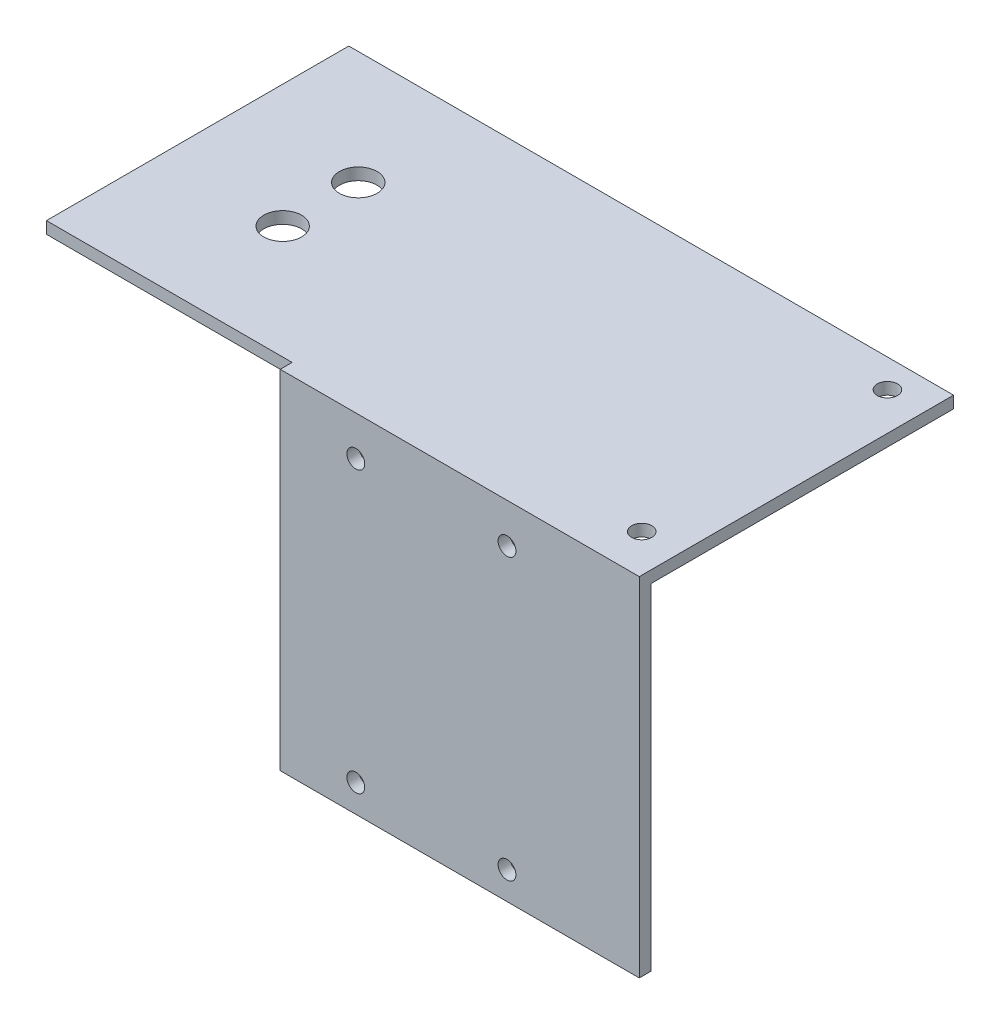
from build123d import *

# Parameters (mm, degrees)
SKETCH1_W           = 60.325
SKETCH1_H           = 58.4
SKETCH1_R           = 1.5
BOSS_EXTRUDE1_DEPTH = 2
BOSS_EXTRUDE2_DEPTH = 50.8
SKETCH3_R           = 1.7
SKETCH3_R_2         = 3.175
CUT_EXTRUDE1_DEPTH  = 100.184200481


with BuildPart() as part:
    # Sketch1 → Boss-Extrude1 (new body)
    with BuildSketch(Plane.XY):
        with Locations((30.1625, 29.2)):
            Rectangle(SKETCH1_W, SKETCH1_H)
        with Locations((12.7, 51.75)):
            Circle(SKETCH1_R, mode=Mode.SUBTRACT)
        with Locations((38.1, 51.75)):
            Circle(SKETCH1_R, mode=Mode.SUBTRACT)
        with Locations((12.7, 4.65)):
            Circle(SKETCH1_R, mode=Mode.SUBTRACT)
        with Locations((38.1, 4.65)):
            Circle(SKETCH1_R, mode=Mode.SUBTRACT)
    extrude(amount=-BOSS_EXTRUDE1_DEPTH)

    # Sketch2 → Boss-Extrude2 (add)
    with BuildSketch(Plane(origin=(0, 0, -2), x_dir=(-1, 0, 0), z_dir=(0, 0, -1))):
        Polygon((0, 56.4), (41.275, 56.4), (41.275, 58.4), (0, 58.4), (-60.325, 58.4), (-60.325, 56.4), align=None)
    extrude(amount=BOSS_EXTRUDE2_DEPTH)

    # Sketch3 → Cut-Extrude1 (cut, through all)
    with BuildSketch(Plane(origin=(0, 58.4, 0), x_dir=(1, 0, 0), z_dir=(0, 1, 0))):
        with Locations((53.975, 48.0375)):
            Circle(SKETCH3_R)
        with Locations((53.975, 6.7625)):
            Circle(SKETCH3_R)
        with Locations((-20.6375, 33.75)):
            Circle(SKETCH3_R_2)
        with Locations((-20.6375, 21.05)):
            Circle(SKETCH3_R_2)
    extrude(amount=-CUT_EXTRUDE1_DEPTH, mode=Mode.SUBTRACT)


solid = part.part
